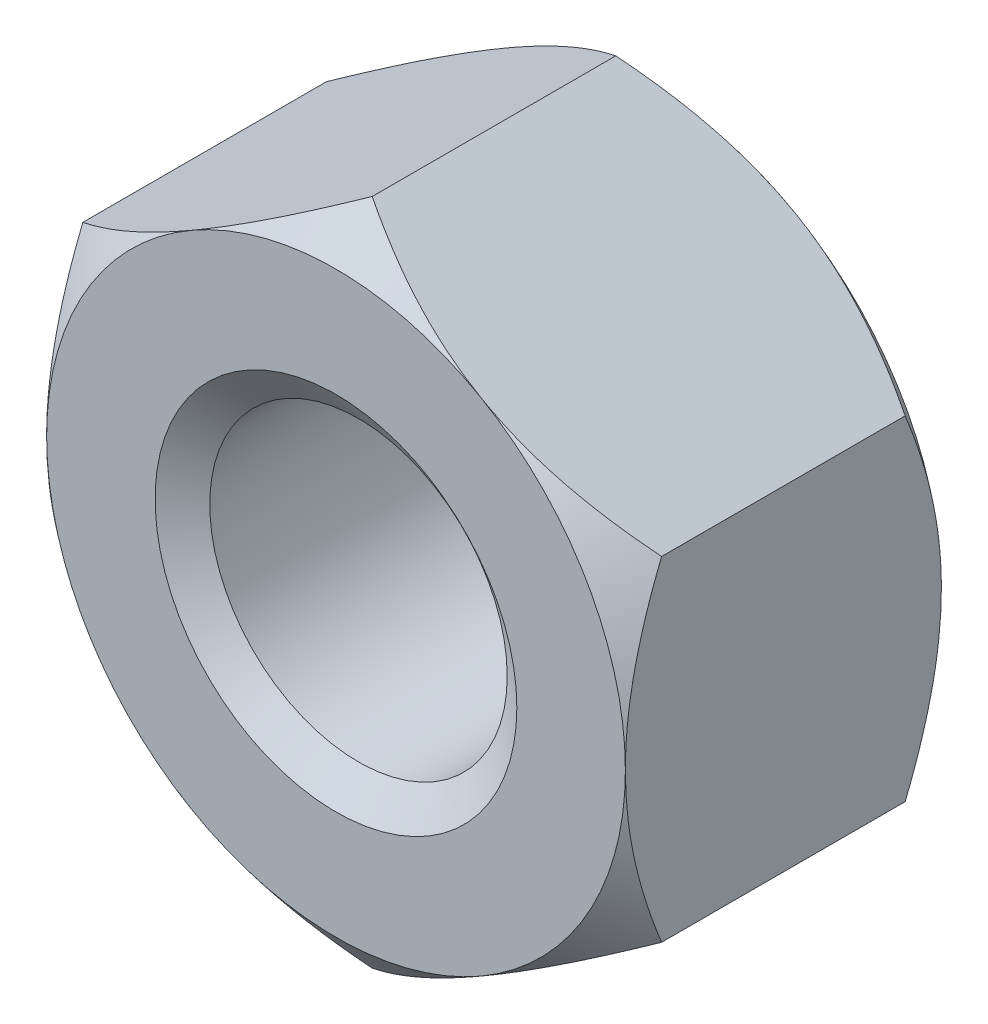
from build123d import *

# Parameters (mm, degrees)
BASENUT_START = -6.9342
BASENUTSKE_R  = 3.2639
BASENUT_DEPTH = 6.9342


# Read off the part's stored shape, not the designer's step: ThreadSchematic
with BuildPart() as part:
    # BaseNutSke → BaseNut (new body)
    with BuildSketch(Plane.XY.offset(BASENUT_START)):
        Polygon((6.35, 3.666174209), (6.35, -3.666174209), (0, -7.332348419), (-6.35, -3.666174209), (-6.35, 3.666174209), (0, 7.332348419), align=None)
        Circle(BASENUTSKE_R, mode=Mode.SUBTRACT)
    extrude(amount=BASENUT_DEPTH)

    # Sketch5 (on Front Plane) → EndChamfer (revolve, cut)
    with BuildSketch(Plane.XY):
        Polygon((6.9088, 3.96875), (6.365904588, 3.193415), (6.9596, 3.193415), (6.9596, 3.96875), align=None)
    revolve(axis=Axis((6.9088, 3.96875, 0), (-0.5735764363510447, -0.8191520442889928, 0)), mode=Mode.SUBTRACT)

    # Sketch3 → Double-Chamfer (revolve, cut)
    with BuildSketch(Plane(origin=(0, 0, 0), x_dir=(0, 0, -1), z_dir=(1, 0, 0))):
        Polygon((6.9342, 6.35), (6.14045, 7.332348419), (6.14045, 20.032348419), (19.6342, 20.032348419), (19.6342, 6.35), align=None)
        Polygon((0.79375, 20.032348419), (-12.7, 20.032348419), (-12.7, 6.35), (0, 6.35), (0.79375, 7.332348419), align=None)
    revolve(axis=Axis((0, 0, 0), (0, 0, -1)), mode=Mode.SUBTRACT)

    # ThreadSchematic outline → ThreadSchematic (revolve, cut)
    with BuildSketch(Plane.XZ):
        Polygon((3.2639, 0), (3.2639, -0.493541283), (3.96875, 0), align=None)
        Polygon((3.96875, -6.9088), (3.2639, -6.415258717), (3.2639, -6.9342), (3.96875, -6.9342), align=None)
    revolve(axis=Axis((0, 0, 0), (0, 0, 1)), mode=Mode.SUBTRACT)


solid = part.part
